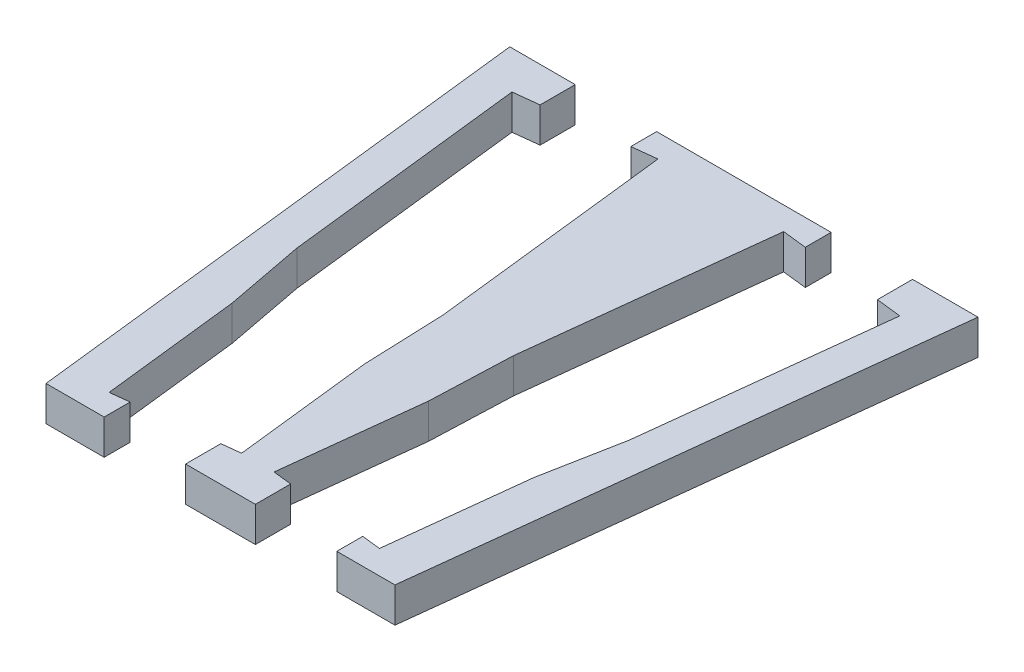
from build123d import *

# Parameters (mm, degrees)
BOSS_EXTRUDE1_DEPTH = 3
CUT_EXTRUDE1_DEPTH  = 102.55958965
BOSS_EXTRUDE2_DEPTH = 3
CUT_EXTRUDE7_DEPTH  = 102.55958965
CUT_EXTRUDE9_DEPTH  = 102.55958965
MIRROR10_DEPTH      = 3


# Read off the part's stored shape, not the designer's step: Mirror10
with BuildPart() as part:
    # Sketch1 → Boss-Extrude1 (new body)
    with BuildSketch(Plane(origin=(0, 0, 0), x_dir=(1, 0, 0), z_dir=(0, 1, 0))):
        Polygon((-20.127102374, 99.5), (-15, 54.5), (0, 54.5), (0, 99.5), align=None)
    extrude(amount=BOSS_EXTRUDE1_DEPTH)

    # Sketch2 → Cut-Extrude1 (cut, symmetric)
    with BuildSketch(Plane(origin=(0, 3, 0), x_dir=(1, 0, 0), z_dir=(0, 1, 0))):
        Polygon((-12.142737213, 56.488519479), (-0.87563237, 57.772243923), (-5.403760921, 97.515118151), (-16.670865764, 96.231393706), align=None)
    extrude(amount=CUT_EXTRUDE1_DEPTH, both=True, mode=Mode.SUBTRACT)

    # Sketch6 → Boss-Extrude2 (add)
    with BuildSketch(Plane(origin=(0, 3, 0), x_dir=(1, 0, 0), z_dir=(0, 1, 0))):
        Polygon((-12.142737213, 56.488519479), (-11.621111989, 56.547951167), (-12.979550554, 68.470813435), (-14.293598275, 75.366384737), align=None)
    boss_extrude2 = extrude(amount=-BOSS_EXTRUDE2_DEPTH)

    # Mirror3: Boss-Extrude2 across plane
    add(boss_extrude2.mirror(Plane(origin=(0, 0, 0), x_dir=(0.11320321376790746, 0, 0.9935718556765873), z_dir=(0.9935718556765875, 0, -0.11320321376790746))))

    # Sketch7 → Cut-Extrude7 (cut, symmetric)
    with BuildSketch(Plane(origin=(0, 3, 0), x_dir=(1, 0, 0), z_dir=(0, 1, 0))):
        Polygon((-14.5, 99.5), (-14.5, 96.478732618), (-7.5, 97.276281876), (-7.5, 99.5), align=None)
    extrude(amount=CUT_EXTRUDE7_DEPTH, both=True, mode=Mode.SUBTRACT)

    # Sketch14 → Cut-Extrude9 (cut, symmetric)
    with BuildSketch(Plane(origin=(0, 3, 0), x_dir=(1, 0, 0), z_dir=(0, 1, 0))):
        Polygon((-10, 56.732653547), (-10, 54.5), (-3, 54.5), (-3, 57.530202805), align=None)
    extrude(amount=CUT_EXTRUDE9_DEPTH, both=True, mode=Mode.SUBTRACT)


with BuildPart() as cut_extrude9_piece_1:
    # of the separate pieces the step leaves, piece 1, a body of its own (cut_extrude9_pieces)
    add(part.part.solids().sort_by_distance((-20.127102374, 0, -99.5))[0])


with BuildPart() as cut_extrude9_piece_2:
    # of the separate pieces the step leaves, piece 2, a body of its own (cut_extrude9_pieces)
    add(part.part.solids().sort_by_distance((-3, 0, -54.5))[0])

    # Mirror10 outline → Mirror10 (add)
    with BuildSketch(Plane(origin=(0, 0, 0), x_dir=(1, 0, 0), z_dir=(0, 1, 0))):
        Polygon((0, 54.5), (3, 54.5), (3, 57.530202805), (1.397257594, 57.712812236), (2.755696159, 69.635674504), (3.026493432, 76.650109181), (5.403760921, 97.515118151), (7.5, 97.276281876), (7.5, 99.5), (0, 99.5), align=None)
    extrude(amount=MIRROR10_DEPTH)


with BuildPart() as body_3:
    # Mirror12: mirrored copy
    add(cut_extrude9_piece_1.part.mirror(Plane(origin=(0, 0, 0), x_dir=(0, 0, 1), z_dir=(1, 0, 0))))


solid = Compound([cut_extrude9_piece_1.part, cut_extrude9_piece_2.part, body_3.part])
